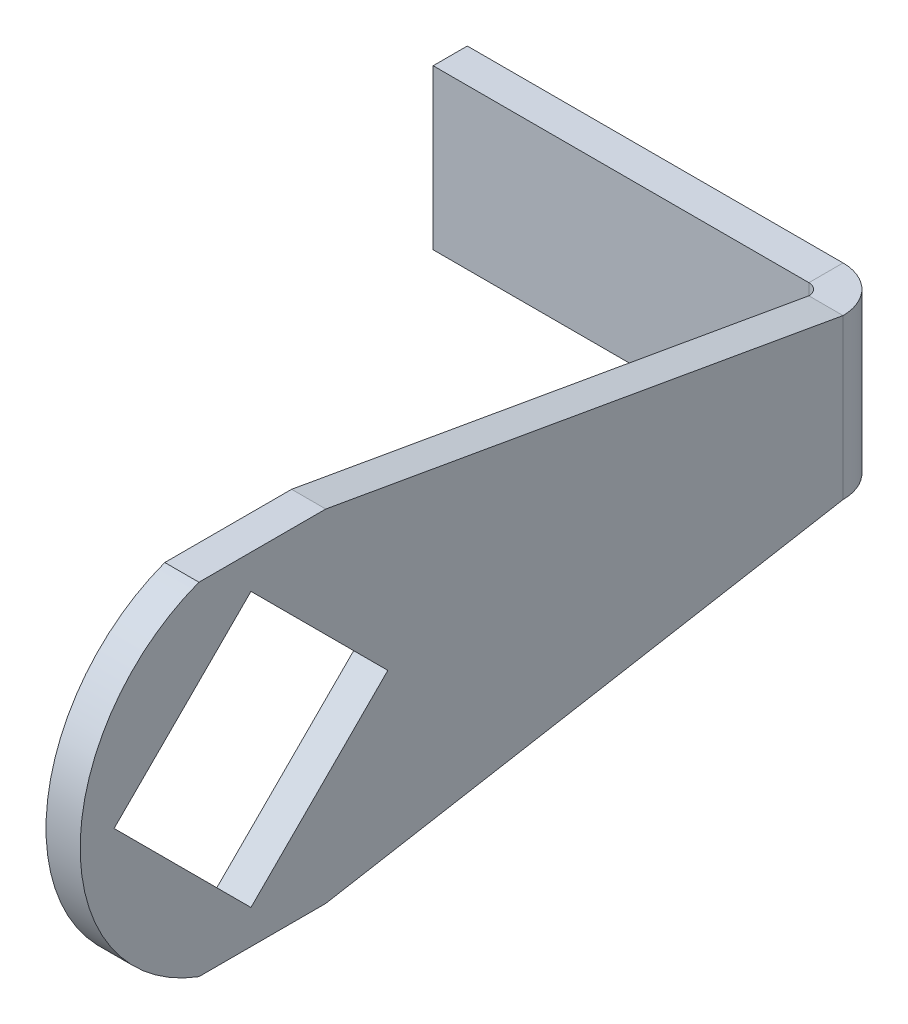
from build123d import *

# Parameters (mm, degrees)
SKETCH_2_W                       = 17
SKETCH_2_H                       = 15
SM_BASE_FLANGE_1_DEPTH           = 1.5
SM_EDGE_FLANGE_1_STRIP_W         = 7
SM_EDGE_FLANGE_1_STRIP_H         = 1.5
SM_EDGE_FLANGE_1_STRIP_CUT_DEPTH = 15
SM_EDGE_FLANGE_1_DEPTH           = 15
CUT_EXTRUDE_4_DEPTH              = 2
CUT_EXTRUDE_START                = -1.5
CUT_EXTRUDE_5_DEPTH              = 18.5


# Read off the part's stored shape, not the designer's step: 切除-拉伸5
# Sheet-metal steps are written as plain solids
with BuildPart() as part:
    # 草图2 → 基体-法兰1 (new body)
    with BuildSketch(Plane.XY):
        Rectangle(SKETCH_2_W, SKETCH_2_H)
    extrude(amount=SM_BASE_FLANGE_1_DEPTH)

    # 边线-法兰1 strip (across the edge) → 边线-法兰1 strip cut (cut)
    with BuildSketch(Plane(origin=(8.5, -7.5, 1.5), x_dir=(-1, 0, 0), z_dir=(0, 1, 0))):
        with Locations((-3, -0.75)):
            Rectangle(SM_EDGE_FLANGE_1_STRIP_W, SM_EDGE_FLANGE_1_STRIP_H)
    extrude(amount=SM_EDGE_FLANGE_1_STRIP_CUT_DEPTH, mode=Mode.SUBTRACT)

    # 边线-法兰1 section (across the edge) → 边线-法兰1 (add)
    with BuildSketch(Plane(origin=(8.5, -7.5, 1.5), x_dir=(-1, 0, 0), z_dir=(0, 1, 0))):
        with BuildLine():
            Line((-1.5, 0.5), (-1.5, 34))
            Line((-1.5, 34), (0, 34))
            Line((0, 34), (0, 0.5))
            ThreePointArc((0, 0.5), (0.146446609, 0.146446609), (0.5, 0))
            Line((0.5, 0), (0.5, -1.5))
            ThreePointArc((0.5, -1.5), (-0.914213562, -0.914213562), (-1.5, 0.5))
        make_face()
    extrude(amount=SM_EDGE_FLANGE_1_DEPTH)

    # 草图17 → 切除-拉伸4 (cut)
    with BuildSketch(Plane(origin=(8.5, 0, 0.26211679), x_dir=(0, 0, 1), z_dir=(-1, 0, 0))):
        Polygon((27.73788321, 6.01040764), (21.72747557, 0), (27.73788321, -6.01040764), (33.74829085, 0), align=None)
    extrude(amount=-CUT_EXTRUDE_4_DEPTH, mode=Mode.SUBTRACT)

    # 切除-拉伸5 outline → 切除-拉伸5 (cut)
    with BuildSketch(Plane(origin=(8.5, 0, 0.26211679), x_dir=(0, 0, 1), z_dir=(-1, 0, 0)).offset(CUT_EXTRUDE_START)):
        Polygon((1.73788321, 3.5), (24.454001029, 7.5), (-0.26211679, 7.5), (-0.26211679, 3.5), align=None)
        with BuildLine():
            Line((35.23788321, 7.5), (30.021765392, 7.5))
            ThreePointArc((30.021765392, 7.5), (33.805647573, 4.567764363), (35.23788321, 0))
            Line((35.23788321, 0), (35.23788321, 7.5))
        make_face()
        with BuildLine():
            Line((35.23788321, -7.5), (35.23788321, 0))
            ThreePointArc((35.23788321, 0), (33.805647573, -4.567764363), (30.021765392, -7.5))
            Line((30.021765392, -7.5), (35.23788321, -7.5))
        make_face()
        Polygon((-0.26211679, -7.5), (24.454001029, -7.5), (1.73788321, -3.5), (-0.26211679, -3.5), align=None)
    extrude(amount=CUT_EXTRUDE_5_DEPTH, mode=Mode.SUBTRACT)


solid = part.part
